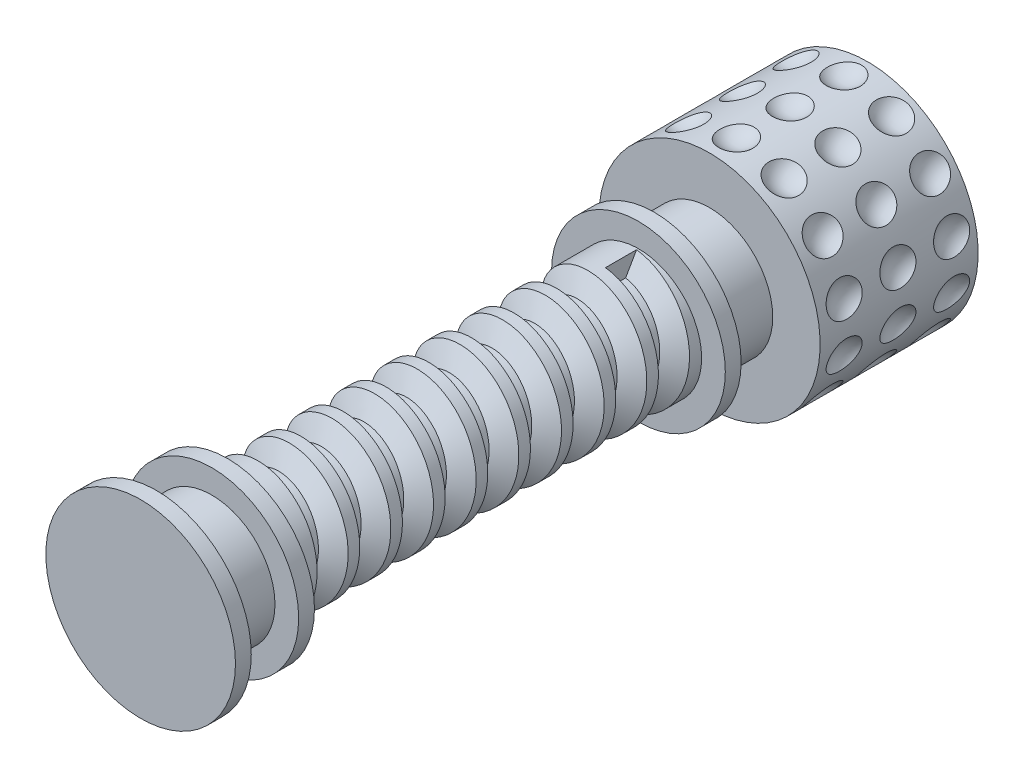
from build123d import *

# Parameters (mm, degrees)
SKETCH2_R              = 4
BOSS_EXTRUDE1_DEPTH    = 36
SKETCH3_R              = 7
BOSS_EXTRUDE2_DEPTH    = 10
BOSS_EXTRUDE5_START    = 3.5
SKETCH4_R              = 5.5
BOSS_EXTRUDE5_DEPTH    = 1
BOSS_EXTRUDE6_START    = 30.5
SKETCH6_R              = 5.5
BOSS_EXTRUDE6_DEPTH    = 1
BOSS_EXTRUDE7_START    = 35
SKETCH7_R              = 6
BOSS_EXTRUDE7_DEPTH    = 1
CUT_SWEEP3_PITCH       = 2.7
CUT_SWEEP3_HEIGHT      = 24
CUT_SWEEP3_RADIUS      = 4
CUT_SWEEP3_START_ANGLE = 90
CIRPATTERN1_COUNT      = 14
SKETCH11_R             = 4
CUT_EXTRUDE1_DEPTH     = 8
FILLET1_R              = 4


with BuildPart() as part:
    # Sketch2 → Boss-Extrude1 (new body)
    with BuildSketch(Plane.XY):
        Circle(SKETCH2_R)
    extrude(amount=BOSS_EXTRUDE1_DEPTH)

    # Sketch3 → Boss-Extrude2 (add)
    with BuildSketch(Plane(origin=(0, 0, 0), x_dir=(-1, 0, 0), z_dir=(0, 0, -1))):
        Circle(SKETCH3_R)
    extrude(amount=BOSS_EXTRUDE2_DEPTH)

    # Sketch4 → Boss-Extrude5 (add)
    with BuildSketch(Plane.XY.offset(BOSS_EXTRUDE5_START)):
        Circle(SKETCH4_R)
    extrude(amount=BOSS_EXTRUDE5_DEPTH)

    # Sketch6 → Boss-Extrude6 (add)
    with BuildSketch(Plane.XY.offset(BOSS_EXTRUDE6_START)):
        Circle(SKETCH6_R)
    extrude(amount=BOSS_EXTRUDE6_DEPTH)

    # Sketch7 → Boss-Extrude7 (add)
    with BuildSketch(Plane.XY.offset(BOSS_EXTRUDE7_START)):
        Circle(SKETCH7_R)
    extrude(amount=BOSS_EXTRUDE7_DEPTH)

    # Cut-Sweep3: sweep along a helix
    with BuildLine() as cut_sweep3_path:
        add(Helix(CUT_SWEEP3_PITCH, CUT_SWEEP3_HEIGHT, CUT_SWEEP3_RADIUS, center=(0, 0, 4.5), direction=(0, 0, 1), lefthand=True, mode=Mode.PRIVATE).rotate(Axis((0, 0, 4.5), (0, 0, 1)), CUT_SWEEP3_START_ANGLE))
    # Sketch9 → Cut-Sweep3 (sweep, cut)
    with BuildSketch(Plane(origin=(0, 0, 0), x_dir=(0, 0, -1), z_dir=(1, 0, 0))):
        Polygon((-4.5, 4.2), (-5.308290377, 2.8), (-5.891709623, 2.8), (-6.7, 4.2), align=None)
    sweep(path=cut_sweep3_path.line, is_frenet=True, mode=Mode.SUBTRACT)

    # Sketch10 → Cut-Revolve1 (revolve, cut)
    with BuildSketch(Plane(origin=(0, 0, 0), x_dir=(0, 0, -1), z_dir=(1, 0, 0))):
        with BuildLine():
            Line((10, 8), (7, 8))
            ThreePointArc((7, 8), (8.5, 6.5), (10, 8))
        make_face()
    cut_revolve1 = revolve(axis=Axis((0, 8, -10), (0, 0, 1)), mode=Mode.SUBTRACT)

    # CirPattern1: Cut-Revolve1 ×14 about axis
    cirpattern1_axis = Axis((0, 0, -10), (0, 0, -1))
    for i in range(1, CIRPATTERN1_COUNT):
        add(cut_revolve1.rotate(cirpattern1_axis, i * 360 / CIRPATTERN1_COUNT), mode=Mode.SUBTRACT)

    # LPattern1 copy 1 sketch → LPattern1 copy 1 (revolve, cut)
    with BuildSketch(Plane(origin=(0, 0, 3.4), x_dir=(0, 0, -1), z_dir=(0.9009688679024191, -0.4338837391175581, 0))):
        with BuildLine():
            Line((10, 8), (7, 8))
            ThreePointArc((7, 8), (8.5, 6.5), (10, 8))
        make_face()
    revolve(axis=Axis((3.471069913, 7.207750943, -6.6), (0, 0, 1)), mode=Mode.SUBTRACT)

    # LPattern1 copy 2 sketch → LPattern1 copy 2 (revolve, cut)
    with BuildSketch(Plane(origin=(0, 0, 6.8), x_dir=(0, 0, -1), z_dir=(0.9009688679024191, -0.4338837391175581, 0))):
        with BuildLine():
            Line((10, 8), (7, 8))
            ThreePointArc((7, 8), (8.5, 6.5), (10, 8))
        make_face()
    revolve(axis=Axis((3.471069913, 7.207750943, -3.2), (0, 0, 1)), mode=Mode.SUBTRACT)

    # LPattern1 copy 3 sketch → LPattern1 copy 3 (revolve, cut)
    with BuildSketch(Plane(origin=(0, 0, 3.4), x_dir=(0, 0, -1), z_dir=(0.6234898018587336, -0.7818314824680298, 0))):
        with BuildLine():
            Line((10, 8), (7, 8))
            ThreePointArc((7, 8), (8.5, 6.5), (10, 8))
        make_face()
    revolve(axis=Axis((6.25465186, 4.987918415, -6.6), (0, 0, 1)), mode=Mode.SUBTRACT)

    # LPattern1 copy 4 sketch → LPattern1 copy 4 (revolve, cut)
    with BuildSketch(Plane(origin=(0, 0, 6.8), x_dir=(0, 0, -1), z_dir=(0.6234898018587336, -0.7818314824680298, 0))):
        with BuildLine():
            Line((10, 8), (7, 8))
            ThreePointArc((7, 8), (8.5, 6.5), (10, 8))
        make_face()
    revolve(axis=Axis((6.25465186, 4.987918415, -3.2), (0, 0, 1)), mode=Mode.SUBTRACT)

    # LPattern1 copy 5 sketch → LPattern1 copy 5 (revolve, cut)
    with BuildSketch(Plane(origin=(0, 0, 3.4), x_dir=(0, 0, -1), z_dir=(0.22252093395631445, -0.9749279121818236, 0))):
        with BuildLine():
            Line((10, 8), (7, 8))
            ThreePointArc((7, 8), (8.5, 6.5), (10, 8))
        make_face()
    revolve(axis=Axis((7.799423297, 1.780167472, -6.6), (0, 0, 1)), mode=Mode.SUBTRACT)

    # LPattern1 copy 6 sketch → LPattern1 copy 6 (revolve, cut)
    with BuildSketch(Plane(origin=(0, 0, 6.8), x_dir=(0, 0, -1), z_dir=(0.22252093395631445, -0.9749279121818236, 0))):
        with BuildLine():
            Line((10, 8), (7, 8))
            ThreePointArc((7, 8), (8.5, 6.5), (10, 8))
        make_face()
    revolve(axis=Axis((7.799423297, 1.780167472, -3.2), (0, 0, 1)), mode=Mode.SUBTRACT)

    # LPattern1 copy 7 sketch → LPattern1 copy 7 (revolve, cut)
    with BuildSketch(Plane(origin=(0, 0, 3.4), x_dir=(0, 0, -1), z_dir=(-0.22252093395631434, -0.9749279121818236, 0))):
        with BuildLine():
            Line((10, 8), (7, 8))
            ThreePointArc((7, 8), (8.5, 6.5), (10, 8))
        make_face()
    revolve(axis=Axis((7.799423297, -1.780167472, -6.6), (0, 0, 1)), mode=Mode.SUBTRACT)

    # LPattern1 copy 8 sketch → LPattern1 copy 8 (revolve, cut)
    with BuildSketch(Plane(origin=(0, 0, 6.8), x_dir=(0, 0, -1), z_dir=(-0.22252093395631434, -0.9749279121818236, 0))):
        with BuildLine():
            Line((10, 8), (7, 8))
            ThreePointArc((7, 8), (8.5, 6.5), (10, 8))
        make_face()
    revolve(axis=Axis((7.799423297, -1.780167472, -3.2), (0, 0, 1)), mode=Mode.SUBTRACT)

    # LPattern1 copy 9 sketch → LPattern1 copy 9 (revolve, cut)
    with BuildSketch(Plane(origin=(0, 0, 3.4), x_dir=(0, 0, -1), z_dir=(-0.6234898018587338, -0.7818314824680296, 0))):
        with BuildLine():
            Line((10, 8), (7, 8))
            ThreePointArc((7, 8), (8.5, 6.5), (10, 8))
        make_face()
    revolve(axis=Axis((6.25465186, -4.987918415, -6.6), (0, 0, 1)), mode=Mode.SUBTRACT)

    # LPattern1 copy 10 sketch → LPattern1 copy 10 (revolve, cut)
    with BuildSketch(Plane(origin=(0, 0, 6.8), x_dir=(0, 0, -1), z_dir=(-0.6234898018587338, -0.7818314824680296, 0))):
        with BuildLine():
            Line((10, 8), (7, 8))
            ThreePointArc((7, 8), (8.5, 6.5), (10, 8))
        make_face()
    revolve(axis=Axis((6.25465186, -4.987918415, -3.2), (0, 0, 1)), mode=Mode.SUBTRACT)

    # LPattern1 copy 11 sketch → LPattern1 copy 11 (revolve, cut)
    with BuildSketch(Plane(origin=(0, 0, 3.4), x_dir=(0, 0, -1), z_dir=(-0.900968867902419, -0.43388373911755823, 0))):
        with BuildLine():
            Line((10, 8), (7, 8))
            ThreePointArc((7, 8), (8.5, 6.5), (10, 8))
        make_face()
    revolve(axis=Axis((3.471069913, -7.207750943, -6.6), (0, 0, 1)), mode=Mode.SUBTRACT)

    # LPattern1 copy 12 sketch → LPattern1 copy 12 (revolve, cut)
    with BuildSketch(Plane(origin=(0, 0, 6.8), x_dir=(0, 0, -1), z_dir=(-0.900968867902419, -0.43388373911755823, 0))):
        with BuildLine():
            Line((10, 8), (7, 8))
            ThreePointArc((7, 8), (8.5, 6.5), (10, 8))
        make_face()
    revolve(axis=Axis((3.471069913, -7.207750943, -3.2), (0, 0, 1)), mode=Mode.SUBTRACT)

    # LPattern1 copy 13 sketch → LPattern1 copy 13 (revolve, cut)
    with BuildSketch(Plane(origin=(0, 0, 3.4), x_dir=(0, 0, -1), z_dir=(-1, 0, 0))):
        with BuildLine():
            Line((10, 8), (7, 8))
            ThreePointArc((7, 8), (8.5, 6.5), (10, 8))
        make_face()
    revolve(axis=Axis((0, -8, -6.6), (0, 0, 1)), mode=Mode.SUBTRACT)

    # LPattern1 copy 14 sketch → LPattern1 copy 14 (revolve, cut)
    with BuildSketch(Plane(origin=(0, 0, 6.8), x_dir=(0, 0, -1), z_dir=(-1, 0, 0))):
        with BuildLine():
            Line((10, 8), (7, 8))
            ThreePointArc((7, 8), (8.5, 6.5), (10, 8))
        make_face()
    revolve(axis=Axis((0, -8, -3.2), (0, 0, 1)), mode=Mode.SUBTRACT)

    # LPattern1 copy 15 sketch → LPattern1 copy 15 (revolve, cut)
    with BuildSketch(Plane(origin=(0, 0, 3.4), x_dir=(0, 0, -1), z_dir=(-0.9009688679024191, 0.433883739117558, 0))):
        with BuildLine():
            Line((10, 8), (7, 8))
            ThreePointArc((7, 8), (8.5, 6.5), (10, 8))
        make_face()
    revolve(axis=Axis((-3.471069913, -7.207750943, -6.6), (0, 0, 1)), mode=Mode.SUBTRACT)

    # LPattern1 copy 16 sketch → LPattern1 copy 16 (revolve, cut)
    with BuildSketch(Plane(origin=(0, 0, 6.8), x_dir=(0, 0, -1), z_dir=(-0.9009688679024191, 0.433883739117558, 0))):
        with BuildLine():
            Line((10, 8), (7, 8))
            ThreePointArc((7, 8), (8.5, 6.5), (10, 8))
        make_face()
    revolve(axis=Axis((-3.471069913, -7.207750943, -3.2), (0, 0, 1)), mode=Mode.SUBTRACT)

    # LPattern1 copy 17 sketch → LPattern1 copy 17 (revolve, cut)
    with BuildSketch(Plane(origin=(0, 0, 3.4), x_dir=(0, 0, -1), z_dir=(-0.6234898018587337, 0.7818314824680297, 0))):
        with BuildLine():
            Line((10, 8), (7, 8))
            ThreePointArc((7, 8), (8.5, 6.5), (10, 8))
        make_face()
    revolve(axis=Axis((-6.25465186, -4.987918415, -6.6), (0, 0, 1)), mode=Mode.SUBTRACT)

    # LPattern1 copy 18 sketch → LPattern1 copy 18 (revolve, cut)
    with BuildSketch(Plane(origin=(0, 0, 6.8), x_dir=(0, 0, -1), z_dir=(-0.6234898018587337, 0.7818314824680297, 0))):
        with BuildLine():
            Line((10, 8), (7, 8))
            ThreePointArc((7, 8), (8.5, 6.5), (10, 8))
        make_face()
    revolve(axis=Axis((-6.25465186, -4.987918415, -3.2), (0, 0, 1)), mode=Mode.SUBTRACT)

    # LPattern1 copy 19 sketch → LPattern1 copy 19 (revolve, cut)
    with BuildSketch(Plane(origin=(0, 0, 3.4), x_dir=(0, 0, -1), z_dir=(-0.2225209339563137, 0.9749279121818237, 0))):
        with BuildLine():
            Line((10, 8), (7, 8))
            ThreePointArc((7, 8), (8.5, 6.5), (10, 8))
        make_face()
    revolve(axis=Axis((-7.799423297, -1.780167472, -6.6), (0, 0, 1)), mode=Mode.SUBTRACT)

    # LPattern1 copy 20 sketch → LPattern1 copy 20 (revolve, cut)
    with BuildSketch(Plane(origin=(0, 0, 6.8), x_dir=(0, 0, -1), z_dir=(-0.2225209339563137, 0.9749279121818237, 0))):
        with BuildLine():
            Line((10, 8), (7, 8))
            ThreePointArc((7, 8), (8.5, 6.5), (10, 8))
        make_face()
    revolve(axis=Axis((-7.799423297, -1.780167472, -3.2), (0, 0, 1)), mode=Mode.SUBTRACT)

    # LPattern1 copy 21 sketch → LPattern1 copy 21 (revolve, cut)
    with BuildSketch(Plane(origin=(0, 0, 3.4), x_dir=(0, 0, -1), z_dir=(0.2225209339563151, 0.9749279121818234, 0))):
        with BuildLine():
            Line((10, 8), (7, 8))
            ThreePointArc((7, 8), (8.5, 6.5), (10, 8))
        make_face()
    revolve(axis=Axis((-7.799423297, 1.780167472, -6.6), (0, 0, 1)), mode=Mode.SUBTRACT)

    # LPattern1 copy 22 sketch → LPattern1 copy 22 (revolve, cut)
    with BuildSketch(Plane(origin=(0, 0, 6.8), x_dir=(0, 0, -1), z_dir=(0.2225209339563151, 0.9749279121818234, 0))):
        with BuildLine():
            Line((10, 8), (7, 8))
            ThreePointArc((7, 8), (8.5, 6.5), (10, 8))
        make_face()
    revolve(axis=Axis((-7.799423297, 1.780167472, -3.2), (0, 0, 1)), mode=Mode.SUBTRACT)

    # LPattern1 copy 23 sketch → LPattern1 copy 23 (revolve, cut)
    with BuildSketch(Plane(origin=(0, 0, 3.4), x_dir=(0, 0, -1), z_dir=(0.6234898018587334, 0.7818314824680299, 0))):
        with BuildLine():
            Line((10, 8), (7, 8))
            ThreePointArc((7, 8), (8.5, 6.5), (10, 8))
        make_face()
    revolve(axis=Axis((-6.25465186, 4.987918415, -6.6), (0, 0, 1)), mode=Mode.SUBTRACT)

    # LPattern1 copy 24 sketch → LPattern1 copy 24 (revolve, cut)
    with BuildSketch(Plane(origin=(0, 0, 6.8), x_dir=(0, 0, -1), z_dir=(0.6234898018587334, 0.7818314824680299, 0))):
        with BuildLine():
            Line((10, 8), (7, 8))
            ThreePointArc((7, 8), (8.5, 6.5), (10, 8))
        make_face()
    revolve(axis=Axis((-6.25465186, 4.987918415, -3.2), (0, 0, 1)), mode=Mode.SUBTRACT)

    # LPattern1 copy 25 sketch → LPattern1 copy 25 (revolve, cut)
    with BuildSketch(Plane(origin=(0, 0, 3.4), x_dir=(0, 0, -1), z_dir=(0.900968867902419, 0.43388373911755834, 0))):
        with BuildLine():
            Line((10, 8), (7, 8))
            ThreePointArc((7, 8), (8.5, 6.5), (10, 8))
        make_face()
    revolve(axis=Axis((-3.471069913, 7.207750943, -6.6), (0, 0, 1)), mode=Mode.SUBTRACT)

    # LPattern1 copy 26 sketch → LPattern1 copy 26 (revolve, cut)
    with BuildSketch(Plane(origin=(0, 0, 6.8), x_dir=(0, 0, -1), z_dir=(0.900968867902419, 0.43388373911755834, 0))):
        with BuildLine():
            Line((10, 8), (7, 8))
            ThreePointArc((7, 8), (8.5, 6.5), (10, 8))
        make_face()
    revolve(axis=Axis((-3.471069913, 7.207750943, -3.2), (0, 0, 1)), mode=Mode.SUBTRACT)

    # LPattern1 copy 27 sketch → LPattern1 copy 27 (revolve, cut)
    with BuildSketch(Plane(origin=(0, 0, 3.4), x_dir=(0, 0, -1), z_dir=(1, 0, 0))):
        with BuildLine():
            Line((10, 8), (7, 8))
            ThreePointArc((7, 8), (8.5, 6.5), (10, 8))
        make_face()
    revolve(axis=Axis((0, 8, -6.6), (0, 0, 1)), mode=Mode.SUBTRACT)

    # LPattern1 copy 28 sketch → LPattern1 copy 28 (revolve, cut)
    with BuildSketch(Plane(origin=(0, 0, 6.8), x_dir=(0, 0, -1), z_dir=(1, 0, 0))):
        with BuildLine():
            Line((10, 8), (7, 8))
            ThreePointArc((7, 8), (8.5, 6.5), (10, 8))
        make_face()
    revolve(axis=Axis((0, 8, -3.2), (0, 0, 1)), mode=Mode.SUBTRACT)

    # Sketch11 → Cut-Extrude1 (cut)
    with BuildSketch(Plane(origin=(0, 0, -10), x_dir=(-1, 0, 0), z_dir=(0, 0, -1))):
        Circle(SKETCH11_R)
    extrude(amount=-CUT_EXTRUDE1_DEPTH, mode=Mode.SUBTRACT)

    # Fillet1
    fillet1_edges = [part.edges().sort_by_distance(p)[0] for p in [
        (4, 0, -2),
    ]]
    fillet(fillet1_edges, radius=FILLET1_R)


solid = part.part
